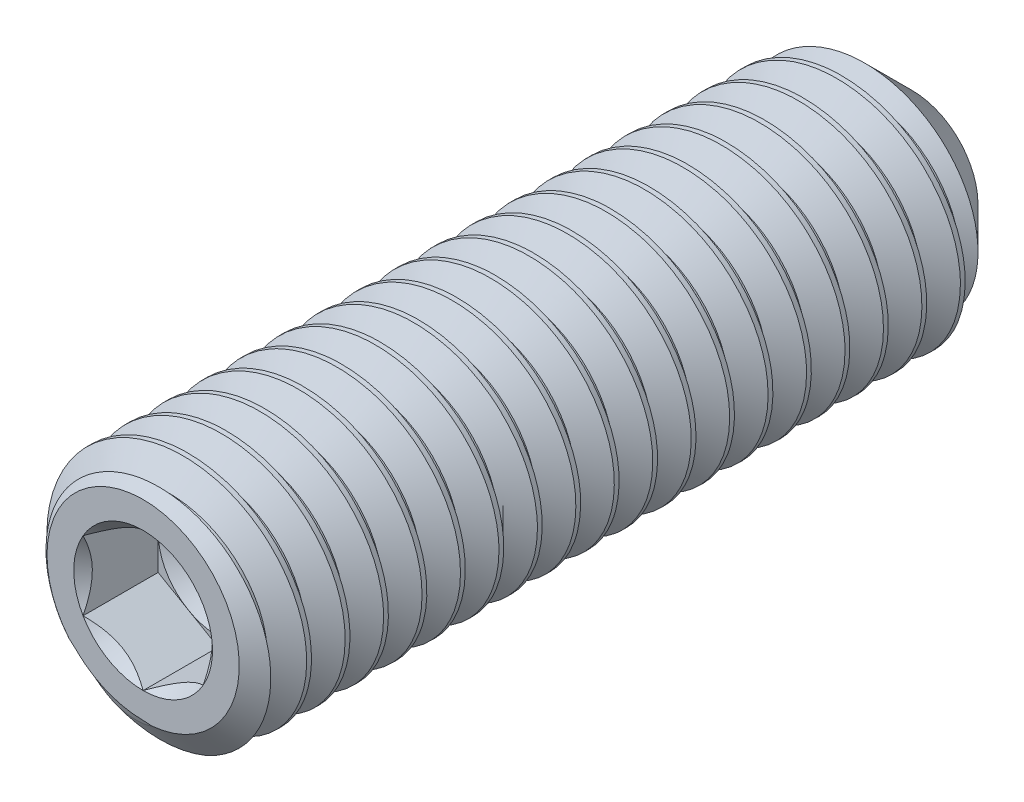
from build123d import *

# Parameters (mm, degrees)
CUT_SWEEP2_PITCH    = 0.8
CUT_EXTRUDE10_DEPTH = 1.5625


with BuildPart() as part:
    # Sketch22 → Revolve1 (revolve)
    with BuildSketch(Plane(origin=(0, 0, 0), x_dir=(0, 0, -1), z_dir=(1, 0, 0)), mode=Mode.PRIVATE) as revolve1_sk:
        Polygon((-7.588436834, 0), (-7.588436834, 2), (-7.238333065, 2.5), (7.281475432, 2.5), (8.411563166, 1.369912266), (7.588436834, 0), align=None)
    revolve(revolve1_sk.sketch.rotate(Axis((0, 0, -7.588436834), (0, 0, -1)), 180), axis=Axis((0, 0, -7.588436834), (0, 0, -1)))

    # Cut-Sweep2: the profile of Sketch28 profile screwed along a right-hand helix of 21 turns, 8 arcs to a turn; built about Z, then put on its axis
    cut_sweep2_z = Axis((0, 0, 0), (0, 0, 1))
    cut_sweep2_corners = [(2.5003, 0, 0.000173205), (2.5003, 0, -0.700173205), (1.980384758, 0, -0.4), (1.980384758, 0, -0.3)]
    with BuildLine(mode=Mode.PRIVATE) as cut_sweep2_profile:
        Line(cut_sweep2_corners[0], cut_sweep2_corners[1])
        Line(cut_sweep2_corners[1], cut_sweep2_corners[2])
        Line(cut_sweep2_corners[2], cut_sweep2_corners[3])
        Line(cut_sweep2_corners[3], cut_sweep2_corners[0])
    cut_sweep2_cap = Face(cut_sweep2_profile.wire())
    cut_sweep2_turn_angles = [0, 22.5, 45, 67.5, 90, 112.5, 135, 157.5, 180, 202.5, 225, 247.5, 270, 292.5, 315, 337.5, 360]
    cut_sweep2_turn_weights = [1, 0.9238795325112867, 1, 0.9238795325112867, 1, 0.9238795325112867, 1, 0.9238795325112867, 1, 0.9238795325112867, 1, 0.9238795325112867, 1, 0.9238795325112867, 1, 0.9238795325112867, 1]
    cut_sweep2_turn_rails = [Edge.make_bspline([Vector(p[0], p[1], 0).rotate(cut_sweep2_z, cut_sweep2_turn_angles[k]) / cut_sweep2_turn_weights[k] + Vector(0, 0, p[2] + CUT_SWEEP2_PITCH * cut_sweep2_turn_angles[k] / 360) for k in range(17)], [0, 0, 0, 1, 1, 2, 2, 3, 3, 4, 4, 5, 5, 6, 6, 7, 7, 8, 8, 8], 2, cut_sweep2_turn_weights) for p in cut_sweep2_corners]
    cut_sweep2_turn_sides = [Face.make_surface_from_curves(cut_sweep2_turn_rails[p[0]], cut_sweep2_turn_rails[p[1]]) for p in [(0, 1), (1, 2), (2, 3), (3, 0)]]
    cut_sweep2 = Plane(origin=(0, 0, -8.411563166), x_dir=(0, 1, 0), z_dir=(0, 0, 1)) * Solid(Shell([*[p.moved(Location((0, 0, CUT_SWEEP2_PITCH * i))) for i in range(21) for p in cut_sweep2_turn_sides], cut_sweep2_cap, cut_sweep2_cap.rotate(cut_sweep2_z, 7560).moved(Location((0, 0, CUT_SWEEP2_PITCH * 7560 / 360)))]))
    add(cut_sweep2, mode=Mode.SUBTRACT)

    # Sketch23 → Cut-Extrude10 (cut)
    with BuildSketch(Plane.XY.offset(7.588436834)):
        Polygon((0, 1.443375673), (-1.25, 0.721687836), (-1.25, -0.721687836), (0, -1.443375673), (1.25, -0.721687836), (1.25, 0.721687836), align=None)
    extrude(amount=-CUT_EXTRUDE10_DEPTH, mode=Mode.SUBTRACT)

    # Cut-Extrude11 cone 1 section (through the dimple's axis) → Cut-Extrude11 (revolve, cut)
    with BuildSketch(Plane(origin=(0, 0, 7.588436834), x_dir=(0, -1, 0), z_dir=(1, 0, 0))):
        Polygon((0, 0), (1.443375673, 0), (0, 1.443375673), align=None)
    revolve(axis=Axis((0, 0, 7.588436834), (0, 0, -1)), mode=Mode.SUBTRACT)

    # Cut-Extrude12 cone 1 section (through the dimple's axis) → Cut-Extrude12 (revolve, cut)
    with BuildSketch(Plane(origin=(0, 0, 6.025936834), x_dir=(0, -1, 0), z_dir=(1, 0, 0))):
        Polygon((0, 0), (1.25, 0), (0, 0.721687836), align=None)
    revolve(axis=Axis((0, 0, 6.025936834), (0, 0, -1)), mode=Mode.SUBTRACT)


solid = part.part
